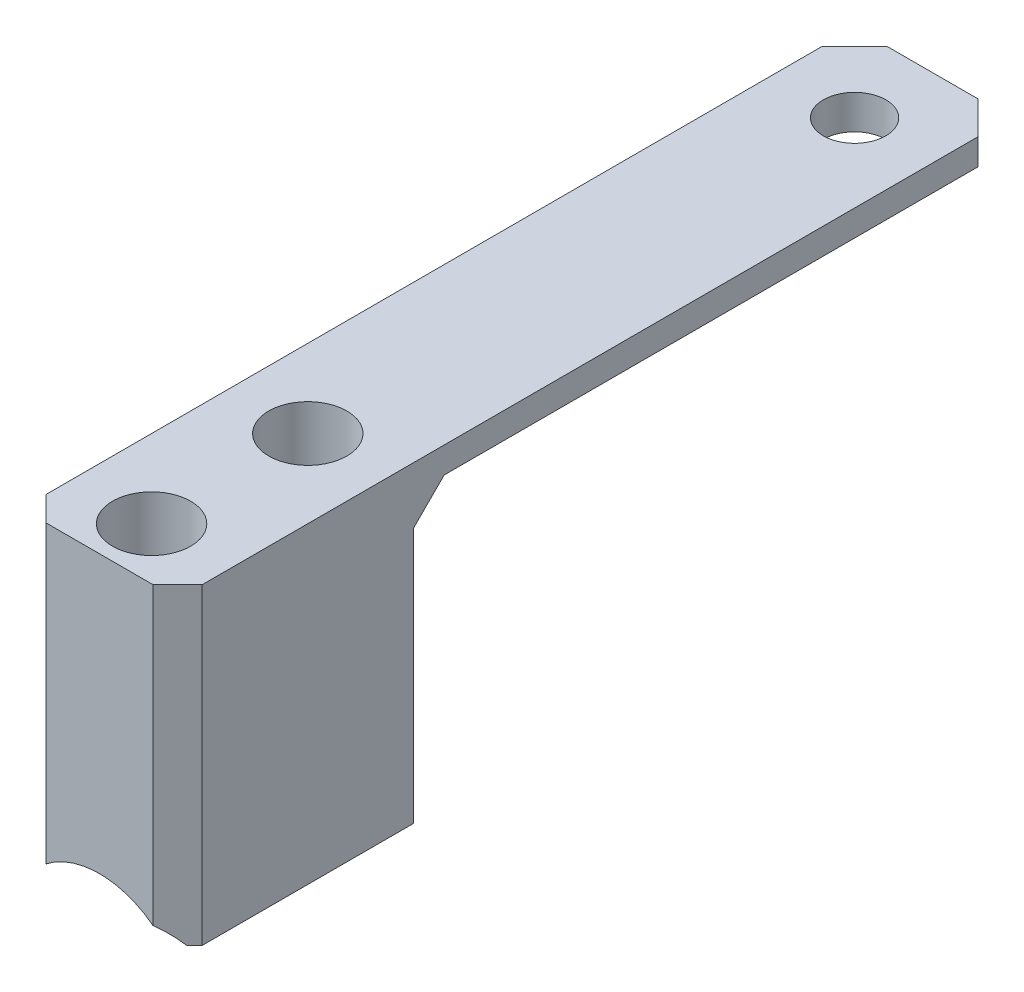
from build123d import *

# Parameters (mm, degrees)
SKETCH1_W           = 19.05
SKETCH1_H           = 31.75
SKETCH1_R           = 3.175
BOSS_EXTRUDE1_DEPTH = 38.1
SKETCH1_8_R         = 3.175
BOSS_EXTRUDE4_DEPTH = 3.175
SKETCH2_R           = 4.7625
CUT_EXTRUDE1_DEPTH  = 25.4
CHAMFER1_SIZE       = 5
CHAMFER2_SIZE       = 3
SKETCH3_R           = 10.67
CUT_EXTRUDE2_DEPTH  = 109.92610167
SKETCH6_R           = 3.81
CUT_EXTRUDE3_DEPTH  = 5.175
BOSS_EXTRUDE6_START = 1
SKETCH6_3_R         = 5.81
SKETCH6_3_R_2       = 3.81
BOSS_EXTRUDE6_DEPTH = 1
CHAMFER3_SIZE       = 1


with BuildPart() as part:
    # Sketch1 → Boss-Extrude1 (new body)
    with BuildSketch(Plane(origin=(0, 0, 0), x_dir=(1, 0, 0), z_dir=(0, 1, 0))):
        with Locations((0, -34.925)):
            Rectangle(SKETCH1_W, SKETCH1_H)
        with Locations(Location((0, -44.45, 0), (0, 0, 270))):
            Circle(SKETCH1_R, mode=Mode.SUBTRACT)
        with Locations(Location((0, -25.4, 0), (0, 0, 270))):
            Circle(SKETCH1_R, mode=Mode.SUBTRACT)
    extrude(amount=-BOSS_EXTRUDE1_DEPTH)

    # Sketch1<8> → Boss-Extrude4 (add)
    with BuildSketch(Plane(origin=(0, 0, 0), x_dir=(1, 0, 0), z_dir=(0, 1, 0))):
        Polygon((9.525, -50.8), (-9.525, -50.8), (-9.525, 46.8), (-5.525, 50.8), (5.525, 50.8), (9.525, 46.8), align=None)
        with Locations(Location((0, -25.4, 0), (0, 0, 270))):
            Circle(SKETCH1_8_R, mode=Mode.SUBTRACT)
        with Locations(Location((0, -44.45, 0), (0, 0, 270))):
            Circle(SKETCH1_8_R, mode=Mode.SUBTRACT)
    extrude(amount=-BOSS_EXTRUDE4_DEPTH)

    # Sketch2 → Cut-Extrude1 (cut)
    with BuildSketch(Plane(origin=(0, 0, 0), x_dir=(1, 0, 0), z_dir=(0, 1, 0))):
        with Locations(Location((0, -25.4, 0), (0, 0, 270))):
            Circle(SKETCH2_R)
        with Locations(Location((0, -44.45, 0), (0, 0, 270))):
            Circle(SKETCH2_R)
    extrude(amount=-CUT_EXTRUDE1_DEPTH, mode=Mode.SUBTRACT)

    # Chamfer1
    chamfer1_edges = [part.edges().sort_by_distance(p)[0] for p in [
        (0, -3.175, 19.05),
    ]]
    chamfer(chamfer1_edges, length=CHAMFER1_SIZE)

    # Chamfer2
    chamfer2_edges = [part.edges().sort_by_distance(p)[0] for p in [
        (-9.525, -23.1375, 19.05),
        (9.525, -23.1375, 19.05),
        (9.525, -19.05, 50.8),
        (-9.525, -19.05, 50.8),
        (9.525, -5.675, 16.55),
        (-9.525, -5.675, 16.55),
    ]]
    chamfer(chamfer2_edges, length=CHAMFER2_SIZE)

    # Sketch3 → Cut-Extrude2 (cut, through all)
    with BuildSketch(Plane.XY.offset(50.8)):
        with Locations((0, -44.45)):
            Circle(SKETCH3_R)
    extrude(amount=-CUT_EXTRUDE2_DEPTH, mode=Mode.SUBTRACT)

    # Sketch6 → Cut-Extrude3 (cut)
    with BuildSketch(Plane.XZ.offset(3.175)):
        with Locations(Location((0, -41.275, 0), (0, 0, 270))):
            Circle(SKETCH6_R)
    extrude(amount=-CUT_EXTRUDE3_DEPTH, mode=Mode.SUBTRACT)

    # Sketch6<3> → Boss-Extrude6 (add)
    with BuildSketch(Plane.XZ.offset(3.175).offset(BOSS_EXTRUDE6_START)):
        with Locations(Location((0, -41.275, 0), (0, 0, 90))):
            Circle(SKETCH6_3_R)
        with Locations(Location((0, -41.275, 0), (0, 0, 270))):
            Circle(SKETCH6_3_R_2, mode=Mode.SUBTRACT)
    extrude(amount=-BOSS_EXTRUDE6_DEPTH)

    # Chamfer3
    chamfer3_edges = [part.edges().sort_by_distance(p)[0] for p in [
        (0, -3.175, -47.085),
    ]]
    chamfer(chamfer3_edges, length=CHAMFER3_SIZE - 0.0001)  # a hair under: the kernel refuses the full size


solid = part.part
